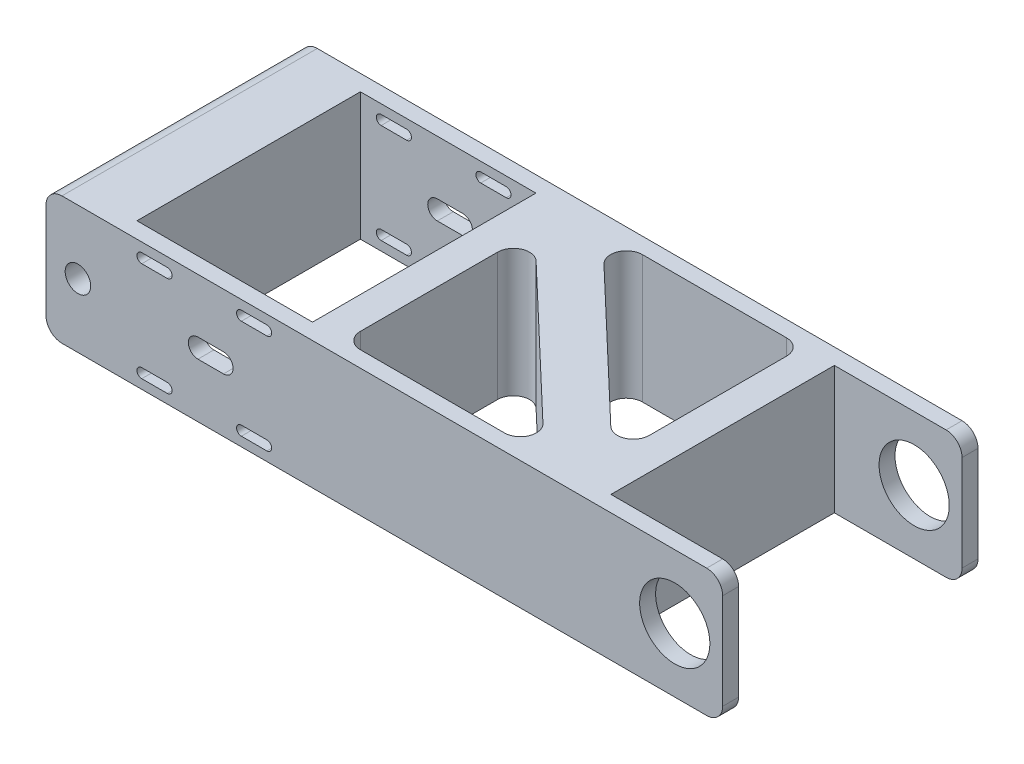
from build123d import *

# Parameters (mm, degrees)
SKETCH1_W               = 212
SKETCH1_H               = 40
SKETCH1_R               = 4
SKETCH1_R_2             = 11
BOSS_EXTRUDE1_DEPTH     = 40
CUT_EXTRUDE3_DEPTH      = 116.047816146
CUT_EXTRUDE3_DEPTH_BACK = 116.047816146
SKETCH2_W               = 55
SKETCH2_H               = 70
SKETCH2_W_2             = 40
FILLET1_R               = 5
FILLET2_R               = 5


with BuildPart() as part:
    # Sketch1 → Boss-Extrude1 (new, symmetric)
    with BuildSketch(Plane.XY):
        Rectangle(SKETCH1_W, SKETCH1_H)
        with BuildLine():
            ThreePointArc((-76, -17.1), (-77.5, -15.6), (-76, -14.1))
            Line((-76, -14.1), (-68, -14.1))
            ThreePointArc((-68, -14.1), (-66.5, -15.6), (-68, -17.1))
            Line((-68, -17.1), (-76, -17.1))
        make_face(mode=Mode.SUBTRACT)
        with BuildLine():
            ThreePointArc((-44.8, -17.1), (-46.3, -15.6), (-44.8, -14.1))
            Line((-44.8, -14.1), (-36.8, -14.1))
            ThreePointArc((-36.8, -14.1), (-35.3, -15.6), (-36.8, -17.1))
            Line((-36.8, -17.1), (-44.8, -17.1))
        make_face(mode=Mode.SUBTRACT)
        with Locations((-96, 0)):
            Circle(SKETCH1_R, mode=Mode.SUBTRACT)
        with BuildLine():
            ThreePointArc((-58.4, -3), (-61.4, 0), (-58.4, 3))
            Line((-58.4, 3), (-50.4, 3))
            ThreePointArc((-50.4, 3), (-47.4, 0), (-50.4, -3))
            Line((-50.4, -3), (-58.4, -3))
        make_face(mode=Mode.SUBTRACT)
        with BuildLine():
            ThreePointArc((-68, 17.1), (-66.939339828, 16.660660172), (-66.5, 15.6))
            ThreePointArc((-66.5, 15.6), (-66.939339828, 14.539339828), (-68, 14.1))
            Line((-68, 14.1), (-76, 14.1))
            ThreePointArc((-76, 14.1), (-77.5, 15.6), (-76, 17.1))
            Line((-76, 17.1), (-68, 17.1))
        make_face(mode=Mode.SUBTRACT)
        with BuildLine():
            ThreePointArc((-44.8, 14.1), (-45.860660172, 14.539339828), (-46.3, 15.6))
            ThreePointArc((-46.3, 15.6), (-45.860660172, 16.660660172), (-44.8, 17.1))
            Line((-44.8, 17.1), (-36.8, 17.1))
            ThreePointArc((-36.8, 17.1), (-35.3, 15.6), (-36.8, 14.1))
            Line((-36.8, 14.1), (-44.8, 14.1))
        make_face(mode=Mode.SUBTRACT)
        with Locations((91, 0)):
            Circle(SKETCH1_R_2, mode=Mode.SUBTRACT)
    extrude(amount=BOSS_EXTRUDE1_DEPTH, both=True)

    # Sketch2 → Cut-Extrude3 (cut, two sides: drawn at the far end of the back side and taken through both)
    with BuildSketch(Plane(origin=(0, 0, 0), x_dir=(1, 0, 0), z_dir=(0, 1, 0)).offset(-CUT_EXTRUDE3_DEPTH_BACK)):
        with Locations((-55, 0)):
            Rectangle(SKETCH2_W, SKETCH2_H)
        Polygon((-17.5, 24.642857143), (45.125, -35), (-17.5, -35), align=None)
        with Locations((86, 0)):
            Rectangle(SKETCH2_W_2, SKETCH2_H)
        Polygon((-6.625, 35), (56, -24.642857143), (56, 35), align=None)
    extrude(amount=CUT_EXTRUDE3_DEPTH + CUT_EXTRUDE3_DEPTH_BACK, mode=Mode.SUBTRACT)

    # Fillet1
    fillet1_edges = [part.edges().sort_by_distance(p)[0] for p in [
        (45.125, 0, 35),
        (-17.5, 0, 35),
        (56, 0, 24.642857143),
        (56, 0, -35),
        (-6.625, 0, -35),
        (-17.5, 0, -24.642857143),
    ]]
    fillet(fillet1_edges, radius=FILLET1_R)

    # Fillet2
    fillet2_edges = [part.edges().sort_by_distance(p)[0] for p in [
        (-106, 20, 0),
        (-106, -20, 0),
        (106, 20, 37.5),
        (106, -20, 37.5),
        (106, 20, -37.5),
        (106, -20, -37.5),
    ]]
    fillet(fillet2_edges, radius=FILLET2_R)


solid = part.part
